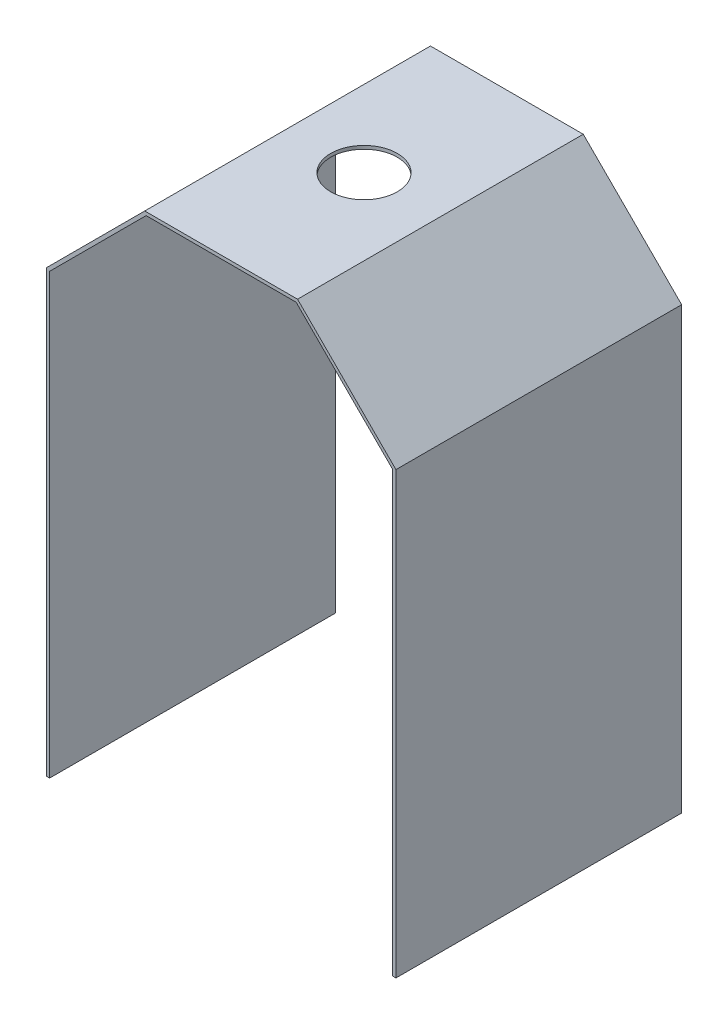
from build123d import *

# Parameters (mm, degrees)
EXTRUDE_1_DEPTH     = 171.62
SKETCH_2_R          = 20
CUT_EXTRUDE_1_DEPTH = 384.382537519


with BuildPart() as part:
    # Эскиз1 → Вытянуть-Тонкостенный1 (new body)
    with BuildSketch(Plane.XY):
        Polygon((-96.72523491, 314.926453532), (-96.72523491, 579.392619017), (-37.621355545, 638.496497272), (54.170886835, 638.496497272), (113.274765367, 579.39261874), (113.27476147, 314.926454672), (111.27476147, 314.926454702), (111.274765355, 578.564191627), (53.34245971, 636.496497272), (-36.792928431, 636.496497272), (-94.72523491, 578.564191882), (-94.72523491, 314.926453532), align=None)
    extrude(amount=EXTRUDE_1_DEPTH)

    # Эскиз2 → Вырез-Вытянуть1 (cut, through all)
    with BuildSketch(Plane(origin=(0, 638.496497272, 0), x_dir=(1, 0, 0), z_dir=(0, 1, 0))):
        with Locations((8.274765645, -85.81)):
            Circle(SKETCH_2_R)
    extrude(amount=-CUT_EXTRUDE_1_DEPTH, mode=Mode.SUBTRACT)


solid = part.part
